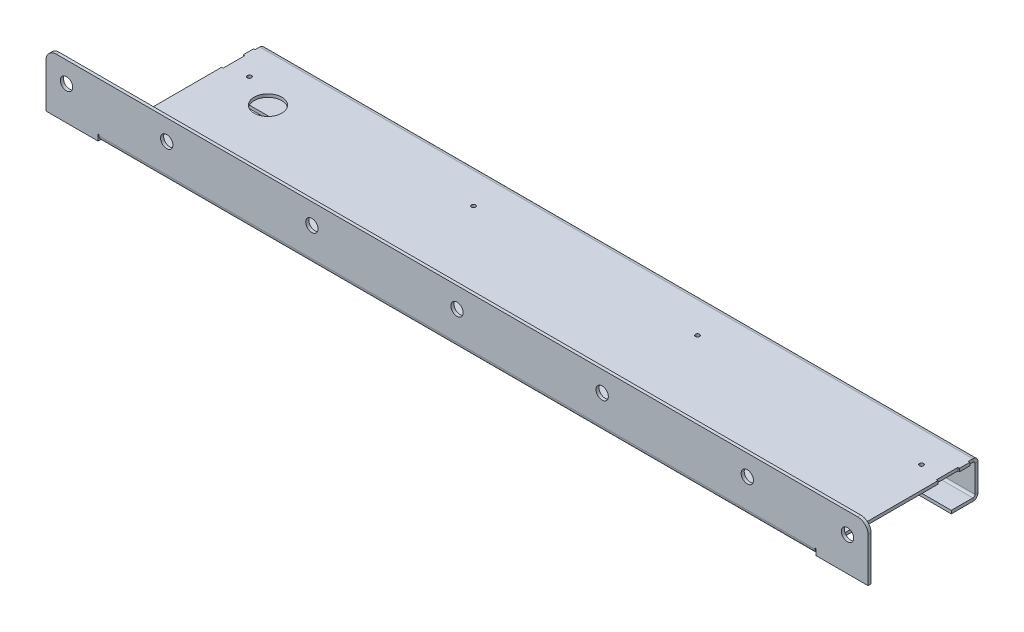
from build123d import *

# Parameters (mm, degrees)
SKETCH2_W                     = 800
SKETCH2_H                     = 53
BASE_FLANGE1_DEPTH            = 3
EDGE_FLANGE1_STRIP_W          = 16
EDGE_FLANGE1_STRIP_H          = 3
EDGE_FLANGE1_STRIP_CUT_DEPTH  = 697
EDGE_FLANGE1_RELIEF_W         = 16.9
EDGE_FLANGE1_RELIEF_H         = 0.9
EDGE_FLANGE1_RELIEF_CUT_DEPTH = 3
EDGE_FLANGE1_DEPTH            = 697
EDGE_FLANGE1_FLAT_DEPTH       = 3
EDGE_FLANGE2_STRIP_W          = 16
EDGE_FLANGE2_STRIP_H          = 3
EDGE_FLANGE2_STRIP_CUT_DEPTH  = 694
EDGE_FLANGE2_DEPTH            = 694
EDGE_FLANGE3_STRIP_W          = 16
EDGE_FLANGE3_STRIP_H          = 3
EDGE_FLANGE3_STRIP_CUT_DEPTH  = 694
EDGE_FLANGE3_DEPTH            = 694
FILLET1_R                     = 10
CUT_EXTRUDE2_DEPTH            = 3
LPATTERN1_COUNT               = 4
LPATTERN1_PITCH               = 195.333333333
SKETCH20_R                    = 6
CUT_EXTRUDE3_DEPTH            = 3
SKETCH21_R                    = 6
CUT_EXTRUDE4_DEPTH            = 3
LPATTERN2_COUNT               = 5
LPATTERN2_PITCH               = 141.25
SKETCH22_R                    = 2
CUT_EXTRUDE5_DEPTH            = 3
LPATTERN3_COUNT               = 4
LPATTERN3_PITCH               = 218
SKETCH23_R                    = 13.5
CUT_EXTRUDE6_DEPTH            = 10


# Sheet-metal steps are written as plain solids
with BuildPart() as part:
    # Sketch2 → Base-Flange1 (new body)
    with BuildSketch(Plane.XY):
        Rectangle(SKETCH2_W, SKETCH2_H)
    extrude(amount=-BASE_FLANGE1_DEPTH)

    # Edge-Flange1 strip (across the edge) → Edge-Flange1 strip cut (cut)
    with BuildSketch(Plane(origin=(348.5, -26.5, -3), x_dir=(0, 1, 0), z_dir=(-1, 0, 0))):
        with Locations((-3, -1.5)):
            Rectangle(EDGE_FLANGE1_STRIP_W, EDGE_FLANGE1_STRIP_H)
    extrude(amount=EDGE_FLANGE1_STRIP_CUT_DEPTH, mode=Mode.SUBTRACT)

    # Edge-Flange1 relief (on the sheet) → Edge-Flange1 relief cut (cut)
    with BuildSketch(Plane(origin=(348.5, -21.5, -3), x_dir=(0, 1, 0), z_dir=(0, 0, -1))):
        with Locations((-7.55, 0.45)):
            Rectangle(EDGE_FLANGE1_RELIEF_W, EDGE_FLANGE1_RELIEF_H)
        with Locations((-7.55, -697.45)):
            Rectangle(EDGE_FLANGE1_RELIEF_W, EDGE_FLANGE1_RELIEF_H)
    extrude(amount=-EDGE_FLANGE1_RELIEF_CUT_DEPTH, mode=Mode.SUBTRACT)

    # Edge-Flange1 bend section (across the edge) → Edge-Flange1 (add)
    with BuildSketch(Plane(origin=(348.5, -26.5, -3), x_dir=(0, 1, 0), z_dir=(-1, 0, 0))):
        with BuildLine():
            Line((0, 2), (3, 2))
            ThreePointArc((3, 2), (3.585786438, 0.585786438), (5, 0))
            Line((5, 0), (5, -3))
            ThreePointArc((5, -3), (1.464466094, -1.535533906), (0, 2))
        make_face()
    extrude(amount=EDGE_FLANGE1_DEPTH)

    # Edge-Flange1 profile (on flange) → Edge-Flange1 flat (add)
    with BuildSketch(Plane(origin=(0, -26.5, -3), x_dir=(1, 0, 0), z_dir=(0, 1, 0))):
        Polygon((-348.5, 16.5), (-348.5, 2), (348.5, 2), (348.5, 16.5), (347, 16.5), (347, 37.5), (348.5, 37.5), (348.5, 116.5), (347, 116.5), (347, 137.5), (348.5, 137.5), (348.5, 147.5), (347, 147.5), (347, 157), (-347, 157), (-347, 147.5), (-348.5, 147.5), (-348.5, 137.5), (-347, 137.5), (-347, 116.5), (-348.5, 116.5), (-348.5, 37.5), (-347, 37.5), (-347, 16.5), align=None)
    extrude(amount=EDGE_FLANGE1_FLAT_DEPTH)

    # Edge-Flange2 strip (across the edge) → Edge-Flange2 strip cut (cut)
    with BuildSketch(Plane(origin=(-347, -26.5, -160), x_dir=(0, 0, 1), z_dir=(1, 0, 0))):
        with Locations((-3, -1.5)):
            Rectangle(EDGE_FLANGE2_STRIP_W, EDGE_FLANGE2_STRIP_H)
    extrude(amount=EDGE_FLANGE2_STRIP_CUT_DEPTH, mode=Mode.SUBTRACT)

    # Edge-Flange2 section (across the edge) → Edge-Flange2 (add)
    with BuildSketch(Plane(origin=(-347, -26.5, -160), x_dir=(0, 0, 1), z_dir=(1, 0, 0))):
        with BuildLine():
            Line((0, 2), (0, 33))
            Line((0, 33), (3, 33))
            Line((3, 33), (3, 2))
            ThreePointArc((3, 2), (3.585786438, 0.585786438), (5, 0))
            Line((5, 0), (5, -3))
            ThreePointArc((5, -3), (1.464466094, -1.535533906), (0, 2))
        make_face()
    extrude(amount=EDGE_FLANGE2_DEPTH)

    # Edge-Flange3 strip (across the edge) → Edge-Flange3 strip cut (cut)
    with BuildSketch(Plane(origin=(-347, -59.5, -157), x_dir=(0, 1, 0), z_dir=(1, 0, 0))):
        with Locations((-3, -1.5)):
            Rectangle(EDGE_FLANGE3_STRIP_W, EDGE_FLANGE3_STRIP_H)
    extrude(amount=EDGE_FLANGE3_STRIP_CUT_DEPTH, mode=Mode.SUBTRACT)

    # Edge-Flange3 section (across the edge) → Edge-Flange3 (add)
    with BuildSketch(Plane(origin=(-347, -59.5, -157), x_dir=(0, 1, 0), z_dir=(1, 0, 0))):
        with BuildLine():
            Line((0, 2), (0, 23))
            Line((0, 23), (3, 23))
            Line((3, 23), (3, 2))
            ThreePointArc((3, 2), (3.585786438, 0.585786438), (5, 0))
            Line((5, 0), (5, -3))
            ThreePointArc((5, -3), (1.464466094, -1.535533906), (0, 2))
        make_face()
    extrude(amount=EDGE_FLANGE3_DEPTH)

    # Fillet1
    fillet1_edges = [part.edges().sort_by_distance(p)[0] for p in [
        (-400, 26.5, -1.5),
        (400, 26.5, -1.5),
    ]]
    fillet(fillet1_edges, radius=FILLET1_R)

    # Sketch19 → Cut-Extrude2 (cut)
    with BuildSketch(Plane(origin=(0, 0, -160), x_dir=(-1, 0, 0), z_dir=(0, 0, -1))):
        Polygon((-286.591412012, -39.5), (-289.795706006, -33.95), (-296.204293994, -33.95), (-299.408587988, -39.5), (-296.204293994, -45.05), (-289.795706006, -45.05), align=None)
    cut_extrude2 = extrude(amount=-CUT_EXTRUDE2_DEPTH, mode=Mode.SUBTRACT)

    # LPattern1: Cut-Extrude2 ×4
    with Locations(*[(-i * LPATTERN1_PITCH, 0, 0) for i in range(1, LPATTERN1_COUNT)]):
        add(cut_extrude2, mode=Mode.SUBTRACT)

    # Sketch20 → Cut-Extrude3 (cut)
    with BuildSketch(Plane(origin=(0, 0, -3), x_dir=(-1, 0, 0), z_dir=(0, 0, -1))):
        with Locations((-380, 6.5)):
            Circle(SKETCH20_R)
        with Locations((380, 6.5)):
            Circle(SKETCH20_R)
    extrude(amount=-CUT_EXTRUDE3_DEPTH, mode=Mode.SUBTRACT)

    # Sketch21 → Cut-Extrude4 (cut)
    with BuildSketch(Plane(origin=(0, 0, -3), x_dir=(-1, 0, 0), z_dir=(0, 0, -1))):
        with Locations((-282.5, 6.5)):
            Circle(SKETCH21_R)
    cut_extrude4 = extrude(amount=-CUT_EXTRUDE4_DEPTH, mode=Mode.SUBTRACT)

    # LPattern2: Cut-Extrude4 ×5
    with Locations(*[(-i * LPATTERN2_PITCH, 0, 0) for i in range(1, LPATTERN2_COUNT)]):
        add(cut_extrude4, mode=Mode.SUBTRACT)

    # Sketch22 → Cut-Extrude5 (cut)
    with BuildSketch(Plane(origin=(0, -23.5, 0), x_dir=(1, 0, 0), z_dir=(0, 1, 0))):
        with Locations(Location((-327, 16, 0), (0, 0, 270))):
            Circle(SKETCH22_R)
        with Locations(Location((-327, 39, 0), (0, 0, 270))):
            Circle(SKETCH22_R)
        with Locations(Location((-327, 125, 0), (0, 0, 270))):
            Circle(SKETCH22_R)
    cut_extrude5 = extrude(amount=-CUT_EXTRUDE5_DEPTH, mode=Mode.SUBTRACT)

    # LPattern3: Cut-Extrude5 ×4
    with Locations(*[(i * LPATTERN3_PITCH, 0, 0) for i in range(1, LPATTERN3_COUNT)]):
        add(cut_extrude5, mode=Mode.SUBTRACT)

    # Sketch23 → Cut-Extrude6 (cut)
    with BuildSketch(Plane(origin=(0, -23.5, 0), x_dir=(1, 0, 0), z_dir=(0, 1, 0))):
        with Locations(Location((-294, 110, 0), (0, 0, 270))):
            Circle(SKETCH23_R)
    extrude(amount=-CUT_EXTRUDE6_DEPTH, mode=Mode.SUBTRACT)


solid = part.part
